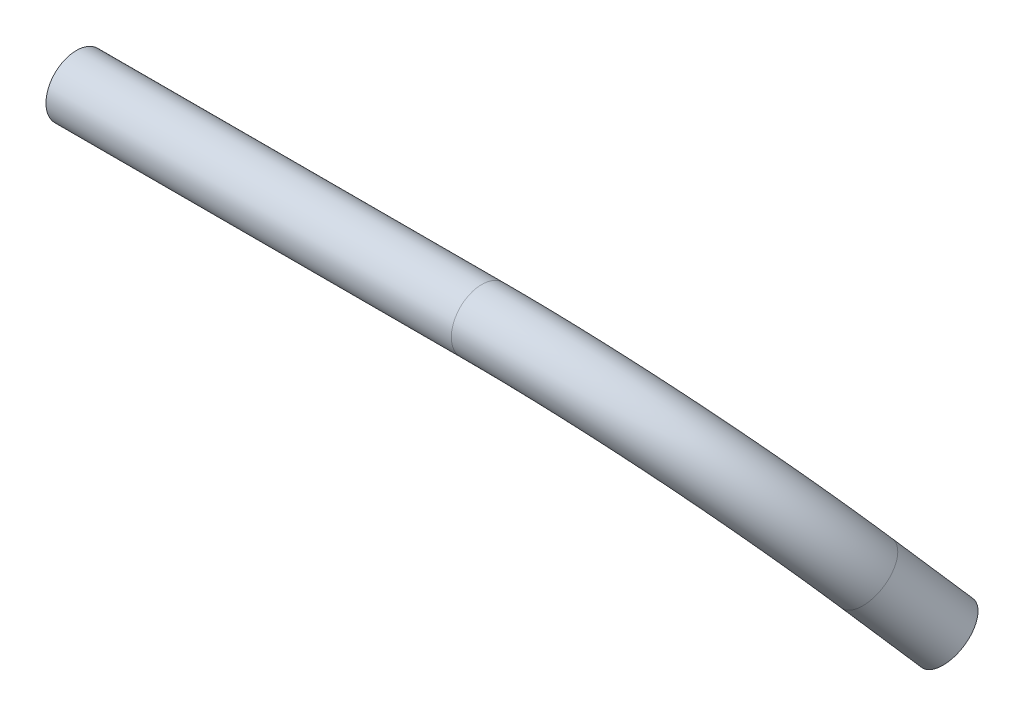
from build123d import *

# Parameters (mm, degrees)
SWEEP1_PROFILE_R     = 9.525
CUT_SWEEP1_PROFILE_R = 8.2804
SWEEP2_PROFILE_R     = 9.525
CUT_SWEEP2_PROFILE_R = 8.2804


with BuildPart() as part:
    # Sweep1: sweep along a path in Sketch1
    with BuildLine(Plane.XY) as sweep1_path:
        Line((0, 0), (101.6, 0))
    # Sweep1 profile (on start of the path) → Sweep1 (sweep)
    with BuildSketch(Plane(origin=(0, 0, 0), x_dir=(0, 0, 1), z_dir=(1, 0, 0))):
        Circle(SWEEP1_PROFILE_R)
    sweep(path=sweep1_path.line)

    # Cut-Sweep1: sweep along a path in Sketch1<2>
    with BuildLine(Plane.XY) as cut_sweep1_path:
        Line((0, 0), (101.6, 0))
    # Cut-Sweep1 profile (on start of the path) → Cut-Sweep1 (sweep, cut)
    with BuildSketch(Plane(origin=(0, 0, 0), x_dir=(0, 0, 1), z_dir=(1, 0, 0))):
        Circle(CUT_SWEEP1_PROFILE_R)
    sweep(path=cut_sweep1_path.line, mode=Mode.SUBTRACT)

    # Sweep2: sweep along a curve in space
    with BuildLine() as sweep2_path:
        Line((101.6, 0, 0), (127, 0, 0))
        ThreePointArc((127, 0, 0), (178.177787695, -11.63970043, -9.329159252), (213.325816715, -42.913048408, -34.394584722))
        Line((213.325816715, -42.913048408, -34.394584722), (224.060320563, -60.87571325, -48.791567007))
    # Sweep2 profile (on start of the path) → Sweep2 (sweep)
    with BuildSketch(Plane.YZ.offset(101.6)):
        Circle(SWEEP2_PROFILE_R)
    sweep(path=sweep2_path.line)

    # Cut-Sweep2: sweep along a curve in space
    with BuildLine() as cut_sweep2_path:
        Line((101.6, 0, 0), (127, 0, 0))
        ThreePointArc((127, 0, 0), (178.177787695, -11.63970043, -9.329159252), (213.325816715, -42.913048408, -34.394584722))
        Line((213.325816715, -42.913048408, -34.394584722), (224.060320563, -60.87571325, -48.791567007))
    # Cut-Sweep2 profile (on start of the path) → Cut-Sweep2 (sweep, cut)
    with BuildSketch(Plane.YZ.offset(101.6)):
        Circle(CUT_SWEEP2_PROFILE_R)
    sweep(path=cut_sweep2_path.line, mode=Mode.SUBTRACT)


solid = part.part
